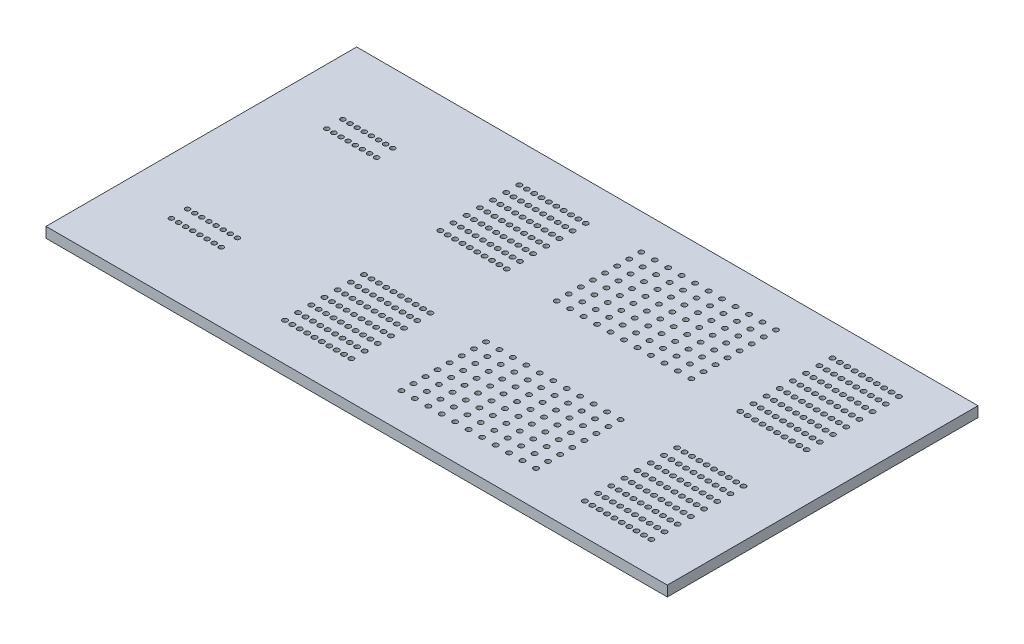
from build123d import *

# Parameters (mm, degrees)
ESQUISSE2_W                     = 120
ESQUISSE2_H                     = 30
BOSS_EXTRU_1_DEPTH              = 2
ENL_V_MAT_EXTRU_3_REACH         = 63.879
ESQUISSE8_R                     = 0.45
R_P_TITION_LIN_AIRE4_COUNT      = 8
R_P_TITION_LIN_AIRE4_PITCH      = 1.377
R_P_TITION_LIN_AIRE4_COUNT_DIR2 = 2
R_P_TITION_LIN_AIRE4_PITCH_DIR2 = 3.111
ENL_V_MAT_EXTRU_4_REACH         = 63.879
ESQUISSE10_R                    = 0.475
R_P_TITION_LIN_AIRE5_COUNT      = 10
R_P_TITION_LIN_AIRE5_PITCH      = 1.425
R_P_TITION_LIN_AIRE5_COUNT_DIR2 = 7
R_P_TITION_LIN_AIRE5_PITCH_DIR2 = 2.545
ENL_V_MAT_EXTRU_5_REACH         = 63.879
ESQUISSE12_R                    = 0.475
R_P_TITION_LIN_AIRE6_COUNT      = 11
R_P_TITION_LIN_AIRE6_PITCH      = 2.6
R_P_TITION_LIN_AIRE6_COUNT_DIR2 = 8
R_P_TITION_LIN_AIRE6_PITCH_DIR2 = 2.333
ENL_V_MAT_EXTRU_6_REACH         = 63.879
ESQUISSE14_R                    = 0.475
R_P_TITION_LIN_AIRE7_COUNT      = 10
R_P_TITION_LIN_AIRE7_PITCH      = 1.425
R_P_TITION_LIN_AIRE7_COUNT_DIR2 = 8
R_P_TITION_LIN_AIRE7_PITCH_DIR2 = 2.545


with BuildPart() as part:
    # Esquisse2 → Boss.-Extru.1 (new body)
    with BuildSketch(Plane(origin=(0, 0, 0), x_dir=(1, 0, 0), z_dir=(0, 1, 0))):
        Rectangle(ESQUISSE2_W, ESQUISSE2_H)
    extrude(amount=BOSS_EXTRU_1_DEPTH)

    # Esquisse8 → Enlèv. mat.-Extru.3 (cut, up to next)
    with BuildSketch(Plane(origin=(0, 2, 0), x_dir=(1, 0, 0), z_dir=(0, 1, 0)), mode=Mode.PRIVATE) as enl_v_mat_extru_3_sk1:
        with Locations((-49.2195, 1.5555)):
            Circle(ESQUISSE8_R)
    enl_v_mat_extru_3_tool1 = extrude(enl_v_mat_extru_3_sk1.sketch, amount=-ENL_V_MAT_EXTRU_3_REACH, mode=Mode.PRIVATE) & part.part
    enl_v_mat_extru_3 = enl_v_mat_extru_3_tool1.solids().sort_by_distance((-49.2195, 2, -1.5555))[0]
    add(enl_v_mat_extru_3, mode=Mode.SUBTRACT)

    # Répétition linéaire4: Enl_v. mat.-Extru.3 8 × 2
    with Locations(*[(i * R_P_TITION_LIN_AIRE4_PITCH, 0, j * R_P_TITION_LIN_AIRE4_PITCH_DIR2) for i in range(R_P_TITION_LIN_AIRE4_COUNT) for j in range(R_P_TITION_LIN_AIRE4_COUNT_DIR2) if (i, j) != (0, 0)]):
        add(enl_v_mat_extru_3, mode=Mode.SUBTRACT)

    # Esquisse10 → Enlèv. mat.-Extru.4 (cut, up to next)
    with BuildSketch(Plane(origin=(0, 2, 0), x_dir=(1, 0, 0), z_dir=(0, 1, 0)), mode=Mode.PRIVATE) as enl_v_mat_extru_4_sk1:
        with Locations((-21.2125, 7.635)):
            Circle(ESQUISSE10_R)
    enl_v_mat_extru_4_tool1 = extrude(enl_v_mat_extru_4_sk1.sketch, amount=-ENL_V_MAT_EXTRU_4_REACH, mode=Mode.PRIVATE) & part.part
    enl_v_mat_extru_4 = enl_v_mat_extru_4_tool1.solids().sort_by_distance((-21.2125, 2, -7.635))[0]
    add(enl_v_mat_extru_4, mode=Mode.SUBTRACT)

    # Répétition linéaire5: Enl_v. mat.-Extru.4 10 × 7
    with Locations(*[(i * R_P_TITION_LIN_AIRE5_PITCH, 0, j * R_P_TITION_LIN_AIRE5_PITCH_DIR2) for i in range(R_P_TITION_LIN_AIRE5_COUNT) for j in range(R_P_TITION_LIN_AIRE5_COUNT_DIR2) if (i, j) != (0, 0)]):
        add(enl_v_mat_extru_4, mode=Mode.SUBTRACT)

    # Esquisse12 → Enlèv. mat.-Extru.5 (cut, up to next)
    with BuildSketch(Plane(origin=(0, 2, 0), x_dir=(1, 0, 0), z_dir=(0, 1, 0)), mode=Mode.PRIVATE) as enl_v_mat_extru_5_sk1:
        with Locations((1.8, 8.1655)):
            Circle(ESQUISSE12_R)
    enl_v_mat_extru_5_tool1 = extrude(enl_v_mat_extru_5_sk1.sketch, amount=-ENL_V_MAT_EXTRU_5_REACH, mode=Mode.PRIVATE) & part.part
    enl_v_mat_extru_5 = enl_v_mat_extru_5_tool1.solids().sort_by_distance((1.8, 2, -8.1655))[0]
    add(enl_v_mat_extru_5, mode=Mode.SUBTRACT)

    # Répétition linéaire6: Enl_v. mat.-Extru.5 11 × 8
    with Locations(*[(i * R_P_TITION_LIN_AIRE6_PITCH, 0, j * R_P_TITION_LIN_AIRE6_PITCH_DIR2) for i in range(R_P_TITION_LIN_AIRE6_COUNT) for j in range(R_P_TITION_LIN_AIRE6_COUNT_DIR2) if (i, j) != (0, 0)]):
        add(enl_v_mat_extru_5, mode=Mode.SUBTRACT)

    # Esquisse14 → Enlèv. mat.-Extru.6 (cut, up to next)
    with BuildSketch(Plane(origin=(0, 2, 0), x_dir=(1, 0, 0), z_dir=(0, 1, 0)), mode=Mode.PRIVATE) as enl_v_mat_extru_6_sk1:
        with Locations((37.9875, 8.9075)):
            Circle(ESQUISSE14_R)
    enl_v_mat_extru_6_tool1 = extrude(enl_v_mat_extru_6_sk1.sketch, amount=-ENL_V_MAT_EXTRU_6_REACH, mode=Mode.PRIVATE) & part.part
    enl_v_mat_extru_6 = enl_v_mat_extru_6_tool1.solids().sort_by_distance((37.9875, 2, -8.9075))[0]
    add(enl_v_mat_extru_6, mode=Mode.SUBTRACT)

    # Répétition linéaire7: Enl_v. mat.-Extru.6 10 × 8
    with Locations(*[(i * R_P_TITION_LIN_AIRE7_PITCH, 0, j * R_P_TITION_LIN_AIRE7_PITCH_DIR2) for i in range(R_P_TITION_LIN_AIRE7_COUNT) for j in range(R_P_TITION_LIN_AIRE7_COUNT_DIR2) if (i, j) != (0, 0)]):
        add(enl_v_mat_extru_6, mode=Mode.SUBTRACT)

    # Symétrie1: part across plane


with BuildPart() as part_1:
    add(part.part)
    add(part.part.mirror(Plane(origin=(-60, 2, 15), x_dir=(1, 0, 0), z_dir=(0, 0, -1))))


solid = part_1.part
